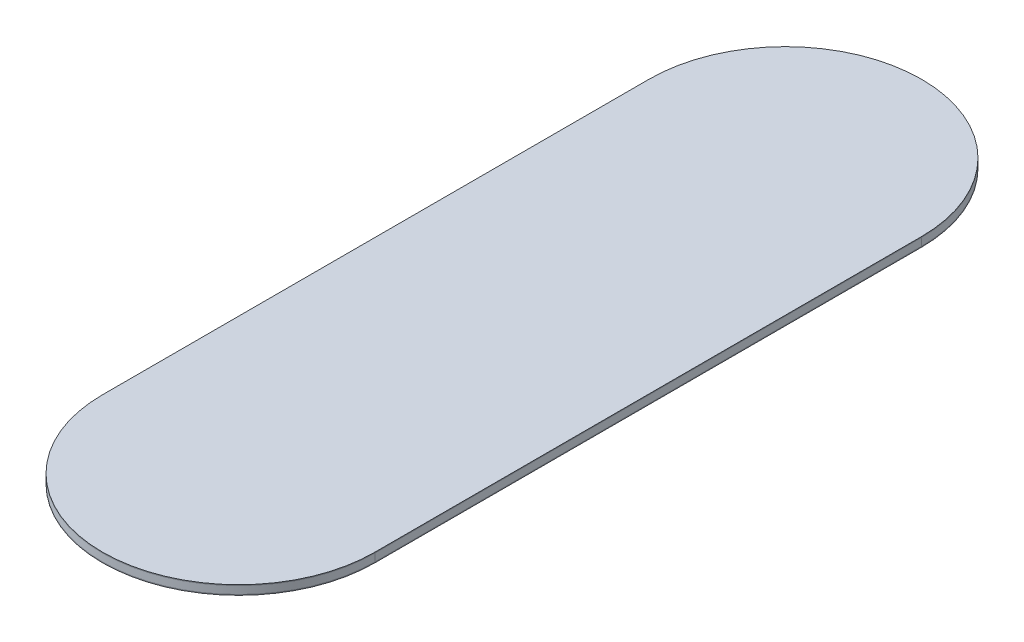
from build123d import *

# Parameters (mm, degrees)
BOSS_EXTRUDE1_DEPTH = 0.25
BOSS_EXTRUDE6_DEPTH = 2.5
BOSS_EXTRUDE7_DEPTH = 0.25


with BuildPart() as part:
    # Sketch1 → Boss-Extrude1 (new body)
    with BuildSketch(Plane(origin=(0, 0, 0), x_dir=(1, 0, 0), z_dir=(0, 1, 0))):
        with BuildLine():
            Line((44.323, 88.9), (44.323, -88.9))
            ThreePointArc((44.323, -88.9), (0, -133.223), (-44.323, -88.9))
            Line((-44.323, -88.9), (-44.323, 88.9))
            ThreePointArc((-44.323, 88.9), (0, 133.223), (44.323, 88.9))
        make_face()
    extrude(amount=BOSS_EXTRUDE1_DEPTH)


with BuildPart() as body_2:
    # Sketch5 → Boss-Extrude6 (new body)
    with BuildSketch(Plane(origin=(0, 0.25, 0), x_dir=(1, 0, 0), z_dir=(0, 1, 0))):
        with BuildLine():
            Line((-44.323, 88.9), (-44.323, -88.9))
            ThreePointArc((-44.323, -88.9), (0, -133.223), (44.323, -88.9))
            Line((44.323, -88.9), (44.323, 88.9))
            ThreePointArc((44.323, 88.9), (0, 133.223), (-44.323, 88.9))
        make_face()
    extrude(amount=BOSS_EXTRUDE6_DEPTH)


with BuildPart() as body_3:
    # Sketch6 → Boss-Extrude7 (new body)
    with BuildSketch(Plane(origin=(0, 2.75, 0), x_dir=(1, 0, 0), z_dir=(0, 1, 0))):
        with BuildLine():
            Line((-44.323, 88.9), (-44.323, -88.9))
            ThreePointArc((-44.323, -88.9), (0, -133.223), (44.323, -88.9))
            Line((44.323, -88.9), (44.323, 88.9))
            ThreePointArc((44.323, 88.9), (0, 133.223), (-44.323, 88.9))
        make_face()
    extrude(amount=BOSS_EXTRUDE7_DEPTH)


solid = Compound([part.part, body_2.part, body_3.part])
